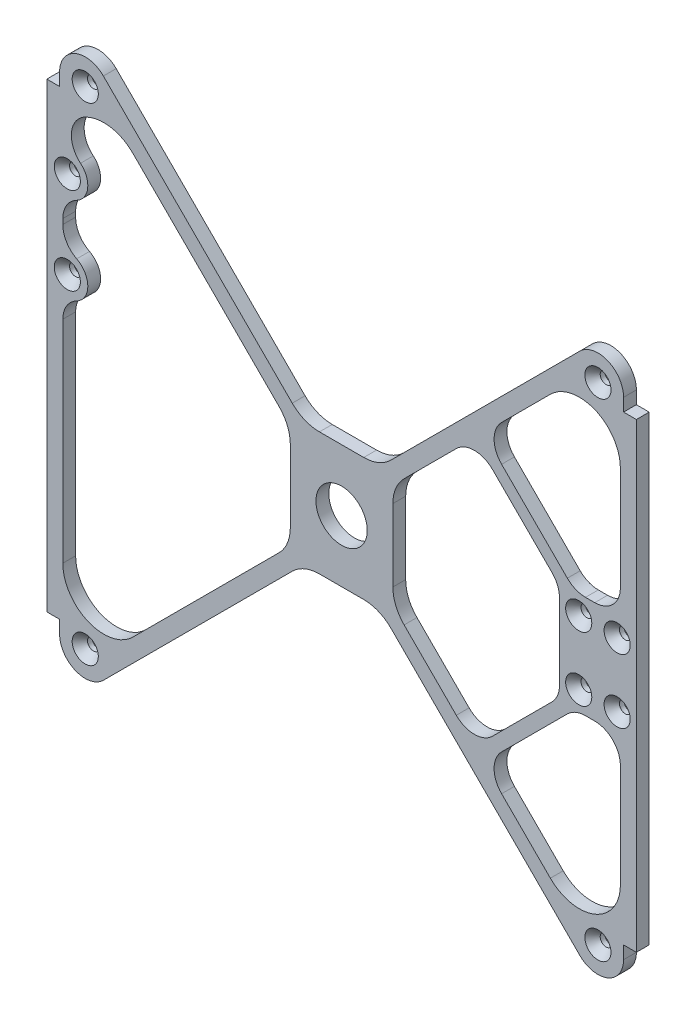
from build123d import *

# Parameters (mm, degrees)
BOSS_EXTRUDE1_DEPTH                           = 3.175
MIRROR2_COPY_1_DEPTH                          = 3.175
MIRROR2_COPY_3_DEPTH                          = 3.175
INTERNAL_SHARPS_R                             = 9.525
BRAKE_MOUNT_DEPTH                             = 3.175
FILLET1_R                                     = 6.35
BEARING_POCKET_REACH                          = 100.936
SKETCH6_R                                     = 6.35
IMU_MOUNTING_DEPTH                            = 3.175
IMU_MOUNTING_HOLES_AT_2_COUNT                 = 2
IMU_MOUNTING_HOLES_AT_2_PITCH                 = 21.59
FILLET4_R                                     = 6.35
CSK_FOR_4_FLAT_HEAD_MACHINE_SCREW2_AT_2_COUNT = 2
CSK_FOR_4_FLAT_HEAD_MACHINE_SCREW2_AT_2_PITCH = 15.875
CSK_FOR_4_FLAT_HEAD_MACHINE_SCREW2_AT_3_COUNT = 2
CSK_FOR_4_FLAT_HEAD_MACHINE_SCREW2_AT_3_PITCH = 18.513272266
CSK_FOR_4_FLAT_HEAD_MACHINE_SCREW2_AT_4_COUNT = 2
CSK_FOR_4_FLAT_HEAD_MACHINE_SCREW2_AT_4_PITCH = 9.525


with BuildPart() as part:
    # Sketch1 → Boss-Extrude1 (new body)
    with BuildSketch(Plane.XY):
        with BuildLine():
            Line((9.434743879, 15.24), (0, 15.24))
            Line((0, 15.24), (0, 0))
            Line((0, 0), (12.7, 0))
            Line((12.7, 0), (12.7, 12.892596045))
            Line((12.7, 12.892596045), (51.712045103, 51.904641149))
            ThreePointArc((51.712045103, 51.904641149), (62.784313673, 54.107052302), (69.05625, 44.720436252))
            Line((69.05625, 44.720436252), (69.05625, 0))
            Line((69.05625, 0), (73.025, 0))
            Line((73.025, 0), (73.025, 57.15))
            Line((73.025, 57.15), (69.85, 57.15))
            Line((69.85, 57.15), (69.85, 60.325))
            ThreePointArc((69.85, 60.325), (65.930039796, 66.191635031), (59.009871939, 64.815128061))
            Line((59.009871939, 64.815128061), (9.434743879, 15.24))
        make_face()
    boss_extrude1 = extrude(amount=BOSS_EXTRUDE1_DEPTH)

    # Sketch11 → CSK for #4 Flat Head Machine Screw1 (revolve, cut)
    with BuildSketch(Plane(origin=(63.5, 60.325, 3.175), x_dir=(0, -1, 0), z_dir=(1, 0, 0))):
        Polygon((0, 0), (0, 3.175), (1.4732, 3.175), (1.4732, 2.030745349), (3.2385, 0), align=None)
    csk_for_4_flat_head_machine_screw1 = revolve(axis=Axis((63.5, 60.325, 9.525), (0, 0, -1)), mode=Mode.SUBTRACT)

    # Mirror1: Boss-Extrude1, CSK for #4 Flat Head Machine Screw1 across plane
    add(boss_extrude1.mirror(Plane.ZX))
    add(csk_for_4_flat_head_machine_screw1.mirror(Plane.ZX), mode=Mode.SUBTRACT)

    # Mirror2 copy 1 sketch → Mirror2 copy 1 (add)
    with BuildSketch(Plane(origin=(0, 0, 0), x_dir=(-1, 0, 0), z_dir=(0, 0, 1))):
        with BuildLine():
            Line((9.434743879, 15.24), (0, 15.24))
            Line((0, 15.24), (0, 0))
            Line((0, 0), (12.7, 0))
            Line((12.7, 0), (12.7, 12.892596045))
            Line((12.7, 12.892596045), (51.712045103, 51.904641149))
            ThreePointArc((51.712045103, 51.904641149), (62.784313673, 54.107052302), (69.05625, 44.720436252))
            Line((69.05625, 44.720436252), (69.05625, 0))
            Line((69.05625, 0), (73.025, 0))
            Line((73.025, 0), (73.025, 57.15))
            Line((73.025, 57.15), (69.85, 57.15))
            Line((69.85, 57.15), (69.85, 60.325))
            ThreePointArc((69.85, 60.325), (65.930039796, 66.191635031), (59.009871939, 64.815128061))
            Line((59.009871939, 64.815128061), (9.434743879, 15.24))
        make_face()
    extrude(amount=MIRROR2_COPY_1_DEPTH)

    # Mirror2 copy 2 sketch → Mirror2 copy 2 (revolve, cut)
    with BuildSketch(Plane(origin=(-63.5, -60.325, 3.175), x_dir=(0, 1, 0), z_dir=(-1, 0, 0))):
        Polygon((0, 0), (0, 3.175), (1.4732, 3.175), (1.4732, 2.030745349), (3.2385, 0), align=None)
    revolve(axis=Axis((-63.5, -60.325, 9.525), (0, 0, -1)), mode=Mode.SUBTRACT)

    # Mirror2 copy 3 sketch → Mirror2 copy 3 (add)
    with BuildSketch(Plane(origin=(0, 0, 0), x_dir=(-1, 0, 0), z_dir=(0, 0, 1))):
        with BuildLine():
            Line((9.434743879, -15.24), (0, -15.24))
            Line((0, -15.24), (0, 0))
            Line((0, 0), (12.7, 0))
            Line((12.7, 0), (12.7, -12.892596045))
            Line((12.7, -12.892596045), (51.712045103, -51.904641149))
            ThreePointArc((51.712045103, -51.904641149), (62.784313673, -54.107052302), (69.05625, -44.720436252))
            Line((69.05625, -44.720436252), (69.05625, 0))
            Line((69.05625, 0), (73.025, 0))
            Line((73.025, 0), (73.025, -57.15))
            Line((73.025, -57.15), (69.85, -57.15))
            Line((69.85, -57.15), (69.85, -60.325))
            ThreePointArc((69.85, -60.325), (65.930039796, -66.191635031), (59.009871939, -64.815128061))
            Line((59.009871939, -64.815128061), (9.434743879, -15.24))
        make_face()
    extrude(amount=MIRROR2_COPY_3_DEPTH)

    # Mirror2 copy 4 sketch → Mirror2 copy 4 (revolve, cut)
    with BuildSketch(Plane(origin=(-63.5, 60.325, 3.175), x_dir=(0, -1, 0), z_dir=(-1, 0, 0))):
        Polygon((0, 0), (0, -3.175), (1.4732, -3.175), (1.4732, -2.030745349), (3.2385, 0), align=None)
    revolve(axis=Axis((-63.5, 60.325, 9.525), (0, 0, 1)), mode=Mode.SUBTRACT)

    # INTERNAL-SHARPS
    internal_sharps_edges = [part.edges().sort_by_distance(p)[0] for p in [
        (9.434743879, 15.24, 1.5875),
        (-9.434743879, 15.24, 1.5875),
        (12.7, -12.892596045, 1.5875),
        (12.7, 12.892596045, 1.5875),
        (9.434743879, -15.24, 1.5875),
        (-9.434743879, -15.24, 1.5875),
        (-12.7, -12.892596045, 1.5875),
        (-12.7, 12.892596045, 1.5875),
    ]]
    fillet(internal_sharps_edges, radius=INTERNAL_SHARPS_R)

    # Sketch5 → BRAKE-MOUNT (add)
    with BuildSketch(Plane.XY):
        Polygon((69.05625, 12.7), (57.785, 12.7), (35.146201977, 35.338798023), (32.901137947, 33.093733992), (53.975, 12.019871939), (53.975, -12.019871939), (32.901137947, -33.093733992), (35.146201977, -35.338798023), (57.785, -12.7), (69.05625, -12.7), align=None)
    extrude(amount=BRAKE_MOUNT_DEPTH)

    # Fillet1
    fillet1_edges = [part.edges().sort_by_distance(p)[0] for p in [
        (69.05625, -12.7, 1.5875),
        (57.785, -12.7, 1.5875),
        (35.146201977, -35.338798023, 1.5875),
        (32.901137947, -33.093733992, 1.5875),
        (53.975, -12.019871939, 1.5875),
        (53.975, 12.019871939, 1.5875),
        (32.901137947, 33.093733992, 1.5875),
        (35.146201977, 35.338798023, 1.5875),
        (57.785, 12.7, 1.5875),
        (69.05625, 12.7, 1.5875),
    ]]
    fillet(fillet1_edges, radius=FILLET1_R)

    # Sketch6 → BEARING-POCKET (cut, up to next)
    with BuildSketch(Plane(origin=(0, 0, 0), x_dir=(-1, 0, 0), z_dir=(0, 0, -1)), mode=Mode.PRIVATE) as bearing_pocket_sk1:
        Circle(SKETCH6_R)
    bearing_pocket_tool1 = extrude(bearing_pocket_sk1.sketch, amount=-BEARING_POCKET_REACH, mode=Mode.PRIVATE) & part.part
    add(bearing_pocket_tool1.solids().sort_by_distance((0, 0, 0))[0], mode=Mode.SUBTRACT)

    # Sketch13 → IMU-MOUNTING (add)
    with BuildSketch(Plane.XY):
        with BuildLine():
            Line((-73.025, 44.45), (-73.025, 12.7))
            Line((-73.025, 12.7), (-67.945, 12.7))
            ThreePointArc((-67.945, 12.7), (-62.895851895, 18.339020045), (-69.05625, 22.736967161))
            Line((-69.05625, 22.736967161), (-69.05625, 34.413032839))
            ThreePointArc((-69.05625, 34.413032839), (-62.895851895, 38.810979955), (-67.945, 44.45))
            Line((-67.945, 44.45), (-73.025, 44.45))
        make_face()
    extrude(amount=IMU_MOUNTING_DEPTH)

    # Sketch15 → IMU-MOUNTING-HOLES (revolve, cut)
    with BuildSketch(Plane(origin=(-67.945, 17.78, 3.175), x_dir=(0, -1, 0), z_dir=(1, 0, 0))):
        Polygon((0, 0), (0, 3.175), (1.4732, 3.175), (1.4732, 2.030745349), (3.2385, 0), align=None)
    imu_mounting_holes = revolve(axis=Axis((-67.945, 17.78, 9.525), (0, 0, -1)), mode=Mode.SUBTRACT)

    # IMU-MOUNTING-HOLES at 2: IMU-MOUNTING-HOLES ×2
    with Locations(*[(0, i * IMU_MOUNTING_HOLES_AT_2_PITCH, 0) for i in range(1, IMU_MOUNTING_HOLES_AT_2_COUNT)]):
        add(imu_mounting_holes, mode=Mode.SUBTRACT)

    # Fillet4
    fillet4_edges = [part.edges().sort_by_distance(p)[0] for p in [
        (-69.05625, 44.45, 1.5875),
        (-69.05625, 12.7, 1.5875),
        (-69.05625, 22.736967161, 1.5875),
        (-69.05625, 34.413032839, 1.5875),
    ]]
    fillet(fillet4_edges, radius=FILLET4_R)

    # Sketch17 → CSK for #4 Flat Head Machine Screw2 (revolve, cut)
    with BuildSketch(Plane(origin=(58.7375, -7.9375, 3.175), x_dir=(0, -1, 0), z_dir=(1, 0, 0))):
        Polygon((0, 0), (0, 3.175), (1.4732, 3.175), (1.4732, 2.030745349), (3.2385, 0), align=None)
    csk_for_4_flat_head_machine_screw2 = revolve(axis=Axis((58.7375, -7.9375, 9.525), (0, 0, -1)), mode=Mode.SUBTRACT)

    # CSK for #4 Flat Head Machine Screw2 at 2: CSK for #4 Flat Head Machine Screw2 ×2
    with Locations(*[(0, i * CSK_FOR_4_FLAT_HEAD_MACHINE_SCREW2_AT_2_PITCH, 0) for i in range(1, CSK_FOR_4_FLAT_HEAD_MACHINE_SCREW2_AT_2_COUNT)]):
        add(csk_for_4_flat_head_machine_screw2, mode=Mode.SUBTRACT)

    # CSK for #4 Flat Head Machine Screw2 at 3: CSK for #4 Flat Head Machine Screw2 ×2
    with Locations(*[Vector(0.5144957554275265, 0.8574929257125442, 0) * (i * CSK_FOR_4_FLAT_HEAD_MACHINE_SCREW2_AT_3_PITCH) for i in range(1, CSK_FOR_4_FLAT_HEAD_MACHINE_SCREW2_AT_3_COUNT)]):
        add(csk_for_4_flat_head_machine_screw2, mode=Mode.SUBTRACT)

    # CSK for #4 Flat Head Machine Screw2 at 4: CSK for #4 Flat Head Machine Screw2 ×2
    with Locations(*[(i * CSK_FOR_4_FLAT_HEAD_MACHINE_SCREW2_AT_4_PITCH, 0, 0) for i in range(1, CSK_FOR_4_FLAT_HEAD_MACHINE_SCREW2_AT_4_COUNT)]):
        add(csk_for_4_flat_head_machine_screw2, mode=Mode.SUBTRACT)


solid = part.part
